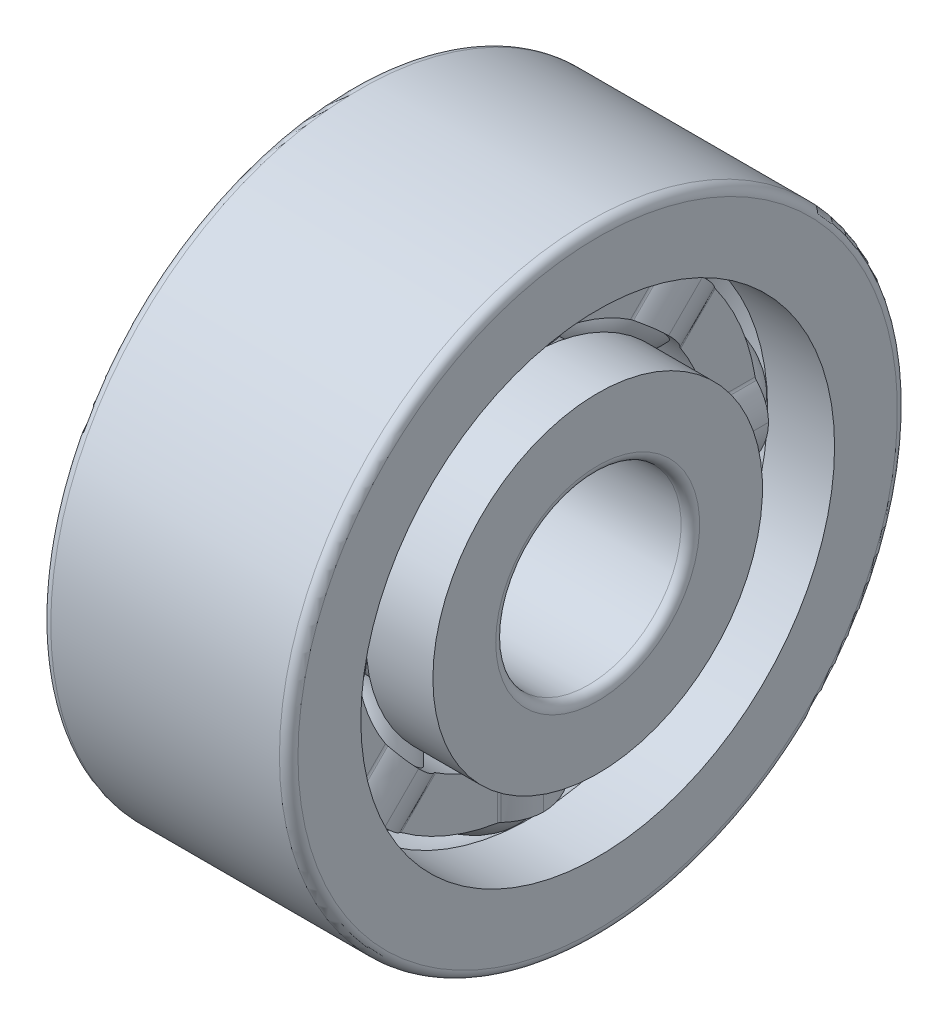
from build123d import *

# Parameters (mm, degrees)
SKETCH10_W                = 2.250281902
SKETCH10_H                = 0.777777778
PATTERN_BALL_COUNT        = 8
COSMETIC_FILLET_OUTER_1_R = 0.15
COSMETIC_FILLET_OUTER_2_R = 0.15
COSMETIC_FILLET_INNER_1_R = 0.15
COSMETIC_FILLET_INNER_2_R = 0.15


with BuildPart() as part:
    # Sketch7 → Body-Ball (revolve)
    with BuildSketch(Plane.XY):
        with BuildLine():
            Line((-1.05, 3.25), (1.05, 3.25))
            ThreePointArc((1.05, 3.25), (0, 2.2), (-1.05, 3.25))
        make_face()
    body_ball = revolve(axis=Axis((-1.05, 3.25, 0), (1, 0, 0)))

    # Sketch10 → Body-Ball-Cage (revolve)
    with BuildSketch(Plane.XY, mode=Mode.PRIVATE) as body_ball_cage_sk:
        with Locations((0, 3.25)):
            Rectangle(SKETCH10_W, SKETCH10_H)
    revolve(body_ball_cage_sk.sketch.rotate(Axis((-2, 0, 0), (1, 0, 0)), 90), axis=Axis((-2, 0, 0), (1, 0, 0)))

    # Sketch16 for Cut-Ball-Cag → Cut-Ball-Cage-1 section 0
    with BuildSketch(Plane(origin=(0, 1.813680646, 0.751251121), x_dir=(-1, 0, 0), z_dir=(-3.4914833611093817e-15, 0.9238795325112837, 0.38268343236509716))):
        with BuildLine():
            Line((0.954580273, -0.190839453), (0.954580273, 0.190839453))
            # circular arc as an exact rational Bezier (weights 1, cos(half-angle), 1)
            Bezier((0.954580273, 0.190839453), (0.954580273, 0.216991824), (0.967914189, 0.239489673), weights=[1, 0.964432576, 1])
            Bezier((0.967914189, 0.239489673), (1.125140951, 0.504772879), (1.125140951, 0.813148354), weights=[1, 0.964432576, 1])
            Line((1.125140951, 0.813148354), (1.125140951, -0.813148354))
            Bezier((1.125140951, -0.813148354), (1.125140951, -0.504772879), (0.967914189, -0.239489673), weights=[1, 0.964432576, 1])
            Bezier((0.967914189, -0.239489673), (0.954580273, -0.216991824), (0.954580273, -0.190839453), weights=[1, 0.964432576, 1])
        make_face()
    # Sketch17 for Cut-Ball-Cag → Cut-Ball-Cage-1 section 1
    with BuildSketch(Plane(origin=(0, 3.734416393, 1.546845918), x_dir=(1, 0, 0), z_dir=(-3.4914833611093844e-15, -0.9238795325112863, -0.3826834323650908))):
        with BuildLine():
            Line((-0.954580273, -1.051985055), (-0.954580273, 1.051985055))
            Bezier((-0.954580273, 1.051985055), (-0.954580273, 1.078137426), (-0.967914189, 1.100635275), weights=[1, 0.964432576, 1])
            Bezier((-0.967914189, 1.100635275), (-1.125140951, 1.365918481), (-1.125140951, 1.674293956), weights=[1, 0.964432576, 1])
            Line((-1.125140951, 1.674293956), (-1.125140951, -1.674293956))
            Bezier((-1.125140951, -1.674293956), (-1.125140951, -1.365918481), (-0.967914189, -1.100635275), weights=[1, 0.964432576, 1])
            Bezier((-0.967914189, -1.100635275), (-0.954580273, -1.078137426), (-0.954580273, -1.051985055), weights=[1, 0.964432576, 1])
        make_face()
    cut_ball_cage_1 = loft(mode=Mode.SUBTRACT)

    # Sketch15 for Cut-Ball-Cag → Cut-Ball-Cage-2 section 0
    with BuildSketch(Plane(origin=(0, 3.734416393, 1.546845918), x_dir=(1, 0, 0), z_dir=(-3.4914833611093844e-15, -0.9238795325112863, -0.3826834323650908))):
        with BuildLine():
            Line((0.954580273, -1.051985055), (0.954580273, 1.051985055))
            Bezier((0.954580273, 1.051985055), (0.954580273, 1.078137426), (0.967914189, 1.100635275), weights=[1, 0.964432576, 1])
            Bezier((0.967914189, 1.100635275), (1.125140951, 1.365918481), (1.125140951, 1.674293956), weights=[1, 0.964432576, 1])
            Line((1.125140951, 1.674293956), (1.125140951, -1.674293956))
            Bezier((1.125140951, -1.674293956), (1.125140951, -1.365918481), (0.967914189, -1.100635275), weights=[1, 0.964432576, 1])
            Bezier((0.967914189, -1.100635275), (0.954580273, -1.078137426), (0.954580273, -1.051985055), weights=[1, 0.964432576, 1])
        make_face()
    # Sketch14 for Cut-Ball-Cag → Cut-Ball-Cage-2 section 1
    with BuildSketch(Plane(origin=(0, 1.813680646, 0.751251121), x_dir=(-1, 0, 0), z_dir=(-3.4914833611093817e-15, 0.9238795325112837, 0.38268343236509716))):
        with BuildLine():
            Line((-0.954580273, -0.190839453), (-0.954580273, 0.190839453))
            Bezier((-0.954580273, 0.190839453), (-0.954580273, 0.216991824), (-0.967914189, 0.239489673), weights=[1, 0.964432576, 1])
            Bezier((-0.967914189, 0.239489673), (-1.125140951, 0.504772879), (-1.125140951, 0.813148354), weights=[1, 0.964432576, 1])
            Line((-1.125140951, 0.813148354), (-1.125140951, -0.813148354))
            Bezier((-1.125140951, -0.813148354), (-1.125140951, -0.504772879), (-0.967914189, -0.239489673), weights=[1, 0.964432576, 1])
            Bezier((-0.967914189, -0.239489673), (-0.954580273, -0.216991824), (-0.954580273, -0.190839453), weights=[1, 0.964432576, 1])
        make_face()
    cut_ball_cage_2 = loft(mode=Mode.SUBTRACT)

    # Pattern-Ball: Body-Ball, Cut-Ball-Cage-1, Cut-Ball-Cage-2 ×8 about axis
    pattern_ball_axis = Axis((-2.75, 0, 0), (1, 0, 0))
    add([body_ball.rotate(pattern_ball_axis, i * 360 / PATTERN_BALL_COUNT) for i in range(1, PATTERN_BALL_COUNT)])
    add([cut_ball_cage_1.rotate(pattern_ball_axis, i * 360 / PATTERN_BALL_COUNT) for i in range(1, PATTERN_BALL_COUNT)], mode=Mode.SUBTRACT)
    add([cut_ball_cage_2.rotate(pattern_ball_axis, i * 360 / PATTERN_BALL_COUNT) for i in range(1, PATTERN_BALL_COUNT)], mode=Mode.SUBTRACT)

    # Sketch2 → Body-Inner (revolve)
    with BuildSketch(Plane.XY, mode=Mode.PRIVATE) as body_inner_sk:
        with BuildLine():
            Line((-2, 2.666666667), (-2, 1.5))
            Line((-2, 1.5), (2, 1.5))
            Line((2, 1.5), (2, 2.666666667))
            Line((2, 2.666666667), (0.915906204, 2.666666667))
            ThreePointArc((0.915906204, 2.666666667), (0, 2.242852814), (-0.915906204, 2.666666667))
            Line((-0.915906204, 2.666666667), (-2, 2.666666667))
        make_face()
    revolve(body_inner_sk.sketch.rotate(Axis((-2, 0, 0), (1, 0, 0)), 90), axis=Axis((-2, 0, 0), (1, 0, 0)))

    # Sketch8 → Body-Outer (revolve)
    with BuildSketch(Plane.XY, mode=Mode.PRIVATE) as body_outer_sk:
        with BuildLine():
            Line((-2, 5), (-2, 3.833333333))
            Line((-2, 3.833333333), (-0.915906204, 3.833333333))
            ThreePointArc((-0.915906204, 3.833333333), (0, 4.257147186), (0.915906204, 3.833333333))
            Line((0.915906204, 3.833333333), (2, 3.833333333))
            Line((2, 3.833333333), (2, 5))
            Line((2, 5), (-2, 5))
        make_face()
    revolve(body_outer_sk.sketch.rotate(Axis((-2, 0, 0), (1, 0, 0)), 90), axis=Axis((-2, 0, 0), (1, 0, 0)))

    # Cosmetic-Fillet-Outer-1
    cosmetic_fillet_outer_1_edges = [part.edges().sort_by_distance(p)[0] for p in [
        (-2, 0, -5),
    ]]
    fillet(cosmetic_fillet_outer_1_edges, radius=COSMETIC_FILLET_OUTER_1_R)

    # Cosmetic-Fillet-Outer-2
    cosmetic_fillet_outer_2_edges = [part.edges().sort_by_distance(p)[0] for p in [
        (2, 0, -5),
    ]]
    fillet(cosmetic_fillet_outer_2_edges, radius=COSMETIC_FILLET_OUTER_2_R)

    # Cosmetic-Fillet-Inner-1
    cosmetic_fillet_inner_1_edges = [part.edges().sort_by_distance(p)[0] for p in [
        (-2, 0, -1.5),
    ]]
    fillet(cosmetic_fillet_inner_1_edges, radius=COSMETIC_FILLET_INNER_1_R)

    # Cosmetic-Fillet-Inner-2
    cosmetic_fillet_inner_2_edges = [part.edges().sort_by_distance(p)[0] for p in [
        (2, 0, -1.5),
    ]]
    fillet(cosmetic_fillet_inner_2_edges, radius=COSMETIC_FILLET_INNER_2_R)


solid = part.part
